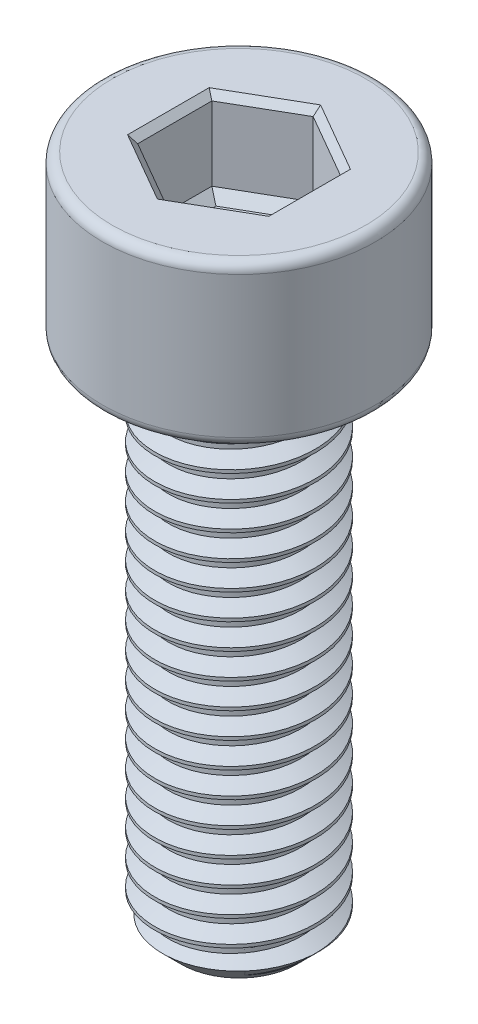
from build123d import *

# Parameters (mm, degrees)
SKETCH1_R           = 2.5
BOSS_EXTRUDE1_DEPTH = 16
THREAD1_PITCH       = 0.8
SKETCH5_R           = 4.25
BOSS_EXTRUDE2_DEPTH = 5
FILLET1_R           = 0.3
CUT_EXTRUDE1_DEPTH  = 2.5
CHAMFER1_SIZE       = 0.2
CUT_EXTRUDE2_DEPTH  = 0.3
CUT_EXTRUDE2_DRAFT  = -45


with BuildPart() as part:
    # Sketch1 → Boss-Extrude1 (new body)
    with BuildSketch(Plane(origin=(0, 0, 0), x_dir=(1, 0, 0), z_dir=(0, 1, 0))):
        with Locations(Location((0, 0, 0), (0, 0, 270))):
            Circle(SKETCH1_R)
    extrude(amount=BOSS_EXTRUDE1_DEPTH)

    # Thread1: the profile of Thread Profile1 profile screwed along a right-hand helix of 21.25 turns, 8 arcs to a turn; built about Z, then put on its axis
    thread1_z = Axis((0, 0, 0), (0, 0, 1))
    thread1_corners = [(2.5003, 0, -0.000173205), (2.5003, 0, 0.700173203), (2.0669873, 0, 0.449999999), (2.0669873, 0, 0.249999999)]
    with BuildLine(mode=Mode.PRIVATE) as thread1_profile:
        Line(thread1_corners[0], thread1_corners[1])
        Line(thread1_corners[1], thread1_corners[2])
        Line(thread1_corners[2], thread1_corners[3])
        Line(thread1_corners[3], thread1_corners[0])
    thread1_cap = Face(thread1_profile.wire())
    thread1_turn_angles = [0, 22.5, 45, 67.5, 90, 112.5, 135, 157.5, 180, 202.5, 225, 247.5, 270, 292.5, 315, 337.5, 360]
    thread1_turn_weights = [1, 0.9238795325112867, 1, 0.9238795325112867, 1, 0.9238795325112867, 1, 0.9238795325112867, 1, 0.9238795325112867, 1, 0.9238795325112867, 1, 0.9238795325112867, 1, 0.9238795325112867, 1]
    thread1_turn_rails = [Edge.make_bspline([Vector(p[0], p[1], 0).rotate(thread1_z, thread1_turn_angles[k]) / thread1_turn_weights[k] + Vector(0, 0, p[2] + THREAD1_PITCH * thread1_turn_angles[k] / 360) for k in range(17)], [0, 0, 0, 1, 1, 2, 2, 3, 3, 4, 4, 5, 5, 6, 6, 7, 7, 8, 8, 8], 2, thread1_turn_weights) for p in thread1_corners]
    thread1_turn_sides = [Face.make_surface_from_curves(thread1_turn_rails[p[0]], thread1_turn_rails[p[1]]) for p in [(0, 1), (1, 2), (2, 3), (3, 0)]]
    thread1_last_angles = [7560, 7582.5, 7605, 7627.5, 7650]
    thread1_last_weights = [1, 0.9238795325112867, 1, 0.9238795325112867, 1]
    thread1_last_rails = [Edge.make_bspline([Vector(p[0], p[1], 0).rotate(thread1_z, thread1_last_angles[k]) / thread1_last_weights[k] + Vector(0, 0, p[2] + THREAD1_PITCH * thread1_last_angles[k] / 360) for k in range(5)], [0, 0, 0, 1, 1, 2, 2, 2], 2, thread1_last_weights) for p in thread1_corners]
    thread1_last_sides = [Face.make_surface_from_curves(thread1_last_rails[p[0]], thread1_last_rails[p[1]]) for p in [(0, 1), (1, 2), (2, 3), (3, 0)]]
    thread1 = Plane(origin=(0, 17, 0), x_dir=(-1, 0, 0), z_dir=(0, -1, 0)) * Solid(Shell([*[p.moved(Location((0, 0, THREAD1_PITCH * i))) for i in range(21) for p in thread1_turn_sides], *thread1_last_sides, thread1_cap, thread1_cap.rotate(thread1_z, 7650).moved(Location((0, 0, THREAD1_PITCH * 7650 / 360)))]))
    add(thread1, mode=Mode.SUBTRACT)

    # Sketch5 → Boss-Extrude2 (add)
    with BuildSketch(Plane(origin=(0, 16, 0), x_dir=(1, 0, 0), z_dir=(0, 1, 0))):
        with Locations(Location((0, 0, 0), (0, 0, 270))):
            Circle(SKETCH5_R)
    extrude(amount=BOSS_EXTRUDE2_DEPTH)

    # Fillet1
    fillet1_edges = [part.edges().sort_by_distance(p)[0] for p in [
        (0, 16, -4.25),
        (0, 21, -4.25),
    ]]
    fillet(fillet1_edges, radius=FILLET1_R)

    # Sketch6 → Cut-Revolve1 (revolve, cut)
    with BuildSketch(Plane.XY, mode=Mode.PRIVATE) as cut_revolve1_sk:
        Polygon((2.51, 0), (2.51, 0.7), (1.81, 0), align=None)
    revolve(cut_revolve1_sk.sketch.rotate(Axis((0, 0, 0), (0, 1, 0)), 318.279472978), axis=Axis((0, 0, 0), (0, 1, 0)), mode=Mode.SUBTRACT)

    # Sketch7 → Cut-Extrude1 (cut)
    with BuildSketch(Plane(origin=(0, 21, 0), x_dir=(1, 0, 0), z_dir=(0, 1, 0))):
        Polygon((0, 2.309401077), (-2, 1.154700538), (-2, -1.154700538), (0, -2.309401077), (2, -1.154700538), (2, 1.154700538), align=None)
    extrude(amount=-CUT_EXTRUDE1_DEPTH, mode=Mode.SUBTRACT)

    # Chamfer1
    chamfer1_edges = [part.edges().sort_by_distance(p)[0] for p in [
        (1, 21, -1.732050808),
        (-1, 21, -1.732050808),
        (-2, 21, 0),
        (-1, 21, 1.732050808),
        (1, 21, 1.732050808),
        (2, 21, 0),
    ]]
    chamfer(chamfer1_edges, length=CHAMFER1_SIZE)


with BuildPart() as cut_extrude2_tool:
    # Sketch8 → Cut-Extrude2 (with draft: the straight prism first)
    with BuildSketch(Plane(origin=(0, 18.5, 0), x_dir=(1, 0, 0), z_dir=(0, 1, 0))):
        Polygon((0, 2.309401077), (-2, 1.154700538), (-2, -1.154700538), (0, -2.309401077), (2, -1.154700538), (2, 1.154700538), align=None)
    extrude(amount=-CUT_EXTRUDE2_DEPTH)
    # Cut-Extrude2: the draft: its side faces are tilted about the plane it starts from
    cut_extrude2_sides = [cut_extrude2_tool.faces().sort_by_distance(p)[0] for p in [
        (-1, 18.35, -1.732050808),
        (-2, 18.35, 0),
        (-1, 18.35, 1.732050808),
        (1, 18.35, 1.732050808),
        (2, 18.35, 0),
        (1, 18.35, -1.732050808),
    ]]
    draft(cut_extrude2_sides, Plane(origin=(0, 18.5, 0), x_dir=(1, 0, 0), z_dir=(0, 1, 0)), CUT_EXTRUDE2_DRAFT)


with BuildPart() as part_1:
    add(part.part)

    # Cut-Extrude2: cut by cut_extrude2_tool
    add(cut_extrude2_tool.part, mode=Mode.SUBTRACT)


solid = part_1.part
